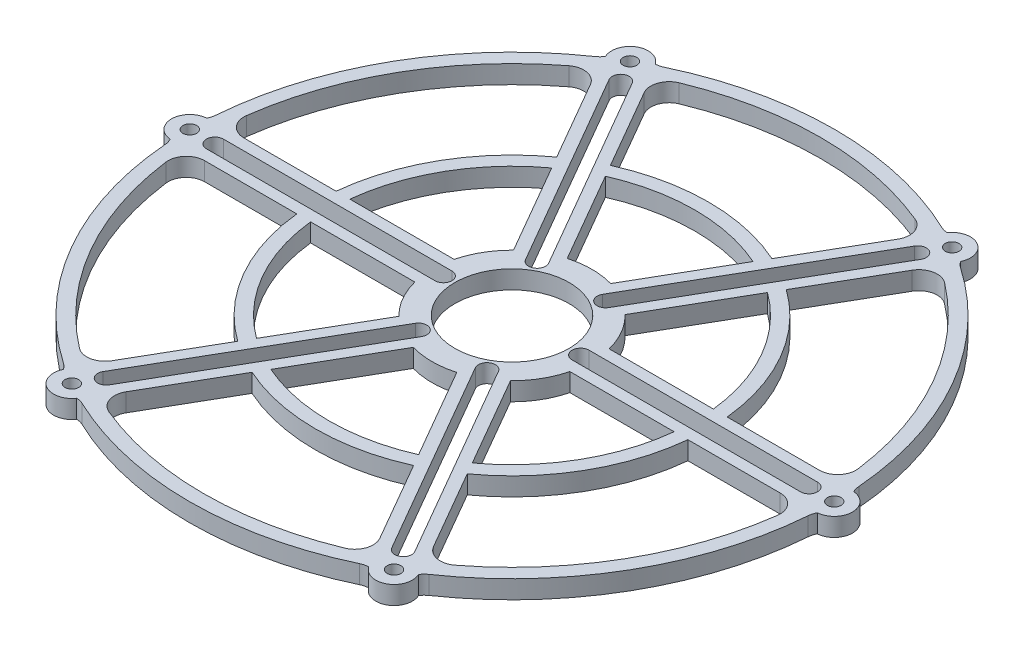
from build123d import *
from build123d.topology import SkipClean

# Parameters (mm, degrees)
SKETCH_1_R           = 1.4999999999999996
SKETCH_1_R_2         = 1.4999999999999998
SKETCH_1_R_3         = 1.5
SKETCH_1_R_4         = 1.4999999999999993
SKETCH_1_R_5         = 1.4999999999999971
SKETCH_1_R_6         = 1.5000000000000007
SKETCH_1_R_7         = 1.4999999999999944
SKETCH_1_R_8         = 1.4999999999999918
SKETCH_1_R_9         = 1.4999999999999887
SKETCH_1_R_10        = 4.5
EXTRUDE_1_DEPTH      = 4
FILLET_1_R           = 4
FILLET_2_R           = 4
EXTRUDE_2_DEPTH      = 5
EXTRUDE_2_DEPTH_BACK = 9
CHAMFER_1_SIZE       = 0.5
SKETCH_3_R           = 43
SKETCH_3_R_2         = 40
EXTRUDE_3_DEPTH      = 4
SKETCH_4_R           = 12.5
CUT_EXTRUDE_1_DEPTH  = 10
SKETCH_5_R           = 17.500000000000004
SKETCH_5_R_2         = 12.5
EXTRUDE_4_DEPTH      = 4
SKETCH_7_R           = 99.6246168555559
CUT_EXTRUDE_3_DEPTH  = 33
SKETCH_8_R           = 104.70068375535166
CUT_EXTRUDE_4_DEPTH  = 205.00000000000003
SKETCH_9_R           = 4.000000000000007
SKETCH_9_R_2         = 1.4999999999999973
SKETCH_9_R_3         = 3.999999999998955
SKETCH_9_R_4         = 1.4999999999989577
SKETCH_9_R_5         = 4.000000000001806
SKETCH_9_R_6         = 1.500000000001791
SKETCH_9_R_7         = 4.0000000000058265
SKETCH_9_R_8         = 1.500000000005815
SKETCH_9_R_9         = 4.000000000007099
SKETCH_9_R_10        = 1.5000000000070977
SKETCH_9_R_11        = 4.000000000004524
SKETCH_9_R_12        = 1.5000000000045177
EXTRUDE_5_DEPTH      = 4
CUT_EXTRUDE_5_DEPTH  = 10


with BuildPart() as part:
    # 草图1 → 凸台-拉伸1 (new body)
    with BuildSketch(Plane(origin=(0, 0, 0), x_dir=(1, 0, 0), z_dir=(0, 1, 0))):
        with BuildLine():
            ThreePointArc((-70.5, 3.000000000000008), (-73.50000000000001, 3.7e-16), (-70.5, -3.000000000000008))
            ThreePointArc((-70.5, -3.000000000000008), (-61.11004418260574, -35.281900459016875), (-37.84807621135403, -59.55479096680248))
            ThreePointArc((-37.84807621135403, -59.55479096680248), (-36.75000000000076, -63.65286717815582), (-32.65192378864741, -62.55479096680256))
            ThreePointArc((-32.65192378864741, -62.55479096680256), (-7.3209e-13, -70.56380091803446), (32.65192378864611, -62.55479096680326))
            ThreePointArc((32.65192378864611, -62.55479096680326), (36.74999999999942, -63.65286717815661), (37.848076211352776, -59.5547909668033))
            ThreePointArc((37.848076211352776, -59.5547909668033), (61.110044182605264, -35.281900459017756), (70.49999999999999, -3.0000000000005))
            ThreePointArc((70.49999999999999, -3.0000000000005), (73.50000000000001, -5.1362e-13), (70.50000000000003, 2.9999999999995155))
            ThreePointArc((70.50000000000003, 2.9999999999995155), (61.11004418260573, 35.28190045901688), (37.84807621135361, 59.55479096680278))
            ThreePointArc((37.84807621135361, 59.55479096680278), (36.75000000000032, 63.65286717815611), (32.65192378864698, 62.55479096680282))
            ThreePointArc((32.65192378864698, 62.55479096680282), (2.3935e-13, 70.5638009180345), (-32.65192378864655, 62.55479096680301))
            ThreePointArc((-32.65192378864655, 62.55479096680301), (-36.74999999999988, 63.65286717815634), (-37.84807621135321, 59.55479096680301))
            ThreePointArc((-37.84807621135321, 59.55479096680301), (-61.110044182605506, 35.281900459017315), (-70.5, 3.000000000000008))
        make_face()
        with Locations(Location((-8, 0, 0), (0, 0, 270))):
            Circle(SKETCH_1_R, mode=Mode.SUBTRACT)
        with Locations(Location((2.793e-14, 8, 0), (0, 0, 270))):
            Circle(SKETCH_1_R_2, mode=Mode.SUBTRACT)
        with Locations(Location((8, -5.586e-14, 0), (0, 0, 270))):
            Circle(SKETCH_1_R_3, mode=Mode.SUBTRACT)
        with Locations(Location((-8.38e-14, -7.999999999999998, 0), (0, 0, 270))):
            Circle(SKETCH_1_R_4, mode=Mode.SUBTRACT)
        with Locations(Location((-70.5, 0, 0), (0, 0, 270))):
            Circle(SKETCH_1_R_5, mode=Mode.SUBTRACT)
        with Locations(Location((-35.24999999999988, 61.05479096680301, 0), (0, 0, 270))):
            Circle(SKETCH_1_R_5, mode=Mode.SUBTRACT)
        with Locations(Location((35.2500000000003, 61.0547909668028, 0), (0, 0, 270))):
            Circle(SKETCH_1_R_6, mode=Mode.SUBTRACT)
        with Locations(Location((70.5, -4.923e-13, 0), (0, 0, 270))):
            Circle(SKETCH_1_R_7, mode=Mode.SUBTRACT)
        with Locations(Location((35.24999999999944, -61.05479096680328, 0), (0, 0, 270))):
            Circle(SKETCH_1_R_8, mode=Mode.SUBTRACT)
        with Locations(Location((-35.25000000000072, -61.054790966802514, 0), (0, 0, 270))):
            Circle(SKETCH_1_R_9, mode=Mode.SUBTRACT)
        with Locations(Location((0, 0, 0), (0, 0, 270))):
            Circle(SKETCH_1_R_10, mode=Mode.SUBTRACT)
        with BuildLine():
            Line((-67.36288251105003, 4.300239505244943), (-9.579036496304667, 4.3002395052442415))
            ThreePointArc((-9.579036496304667, 4.3002395052442415), (-9.093266739736535, 5.250000000000124), (-8.513634902051102, 6.145569196956236))
            Line((-8.513634902051102, 6.145569196956236), (-37.405557909423486, 56.187847774094074))
            ThreePointArc((-37.405557909423486, 56.187847774094074), (-58.45671475544931, 33.75000000000055), (-67.36288251105003, 4.300239505244943))
        make_face(mode=Mode.SUBTRACT)
        with BuildLine():
            Line((-67.36288251105012, -4.300239505243795), (-9.579036496304774, -4.300239505243998))
            ThreePointArc((-9.579036496304774, -4.300239505243998), (-9.093266739736634, -5.249999999999946), (-8.513634902051185, -6.145569196956118))
            Line((-8.513634902051185, -6.145569196956118), (-37.405557909424274, -56.18784777409356))
            ThreePointArc((-37.405557909424274, -56.18784777409356), (-58.45671475544982, -33.749999999999666), (-67.36288251105012, -4.300239505243795))
        make_face(mode=Mode.SUBTRACT)
        with BuildLine():
            Line((9.579036496304996, 4.300239505243507), (67.36288251105015, 4.300239505243303))
            ThreePointArc((67.36288251105015, 4.300239505243303), (58.45671475544981, 33.74999999999966), (37.40555790942386, 56.187847774093825))
            Line((37.40555790942386, 56.187847774093825), (8.513634902050875, 6.145569196956556))
            ThreePointArc((8.513634902050875, 6.145569196956556), (9.093266739736636, 5.249999999999946), (9.579036496304996, 4.300239505243507))
        make_face(mode=Mode.SUBTRACT)
        with BuildLine():
            Line((9.579036496304743, -4.3002395052440665), (67.36288251105009, -4.300239505244269))
            ThreePointArc((67.36288251105009, -4.300239505244269), (58.45671475544934, -33.7500000000005), (37.405557909423074, -56.18784777409434))
            Line((37.405557909423074, -56.18784777409434), (8.513634902050788, -6.145569196956676))
            ThreePointArc((8.513634902050788, -6.145569196956676), (9.093266739736448, -5.250000000000277), (9.579036496304743, -4.3002395052440665))
        make_face(mode=Mode.SUBTRACT)
        with BuildLine():
            Line((1.0654015942535602, -10.445808702200226), (29.957324601625945, -60.48808727933805))
            ThreePointArc((29.957324601625945, -60.48808727933805), (-7.1529e-13, -67.50000000000001), (-29.957324601627235, -60.48808727933743))
            Line((-29.957324601627235, -60.48808727933743), (-1.0654015942542432, -10.44580870220016))
            ThreePointArc((-1.0654015942542432, -10.44580870220016), (-3.4441e-13, -10.500000000000004), (1.0654015942535602, -10.445808702200226))
        make_face(mode=Mode.SUBTRACT)
        with BuildLine():
            Line((-29.957324601626386, 60.48808727933784), (-1.065401594254097, 10.44580870220017))
            ThreePointArc((-1.065401594254097, 10.44580870220017), (-1.952e-13, 10.500000000000004), (1.065401594253708, 10.445808702200214))
            Line((1.065401594253708, 10.445808702200214), (29.957324601626794, 60.48808727933765))
            ThreePointArc((29.957324601626794, 60.48808727933765), (2.1397e-13, 67.50000000000003), (-29.957324601626386, 60.48808727933784))
        make_face(mode=Mode.SUBTRACT)
    extrude(amount=EXTRUDE_1_DEPTH)

    # 圆角1
    fillet_1_edges = [part.edges().sort_by_distance(p)[0] for p in [
        (-32.651923788646556, 2, -62.554790966803),
        (32.65192378864698, 2, -62.55479096680281),
        (37.848076211353614, 2, -59.55479096680278),
        (70.50000000000003, 2, -2.9999999999995124),
        (70.49999999999997, 2, 3.000000000000502),
        (37.848076211352776, 2, 59.554790966803296),
        (32.651923788646116, 2, 62.55479096680326),
        (-32.65192378864741, 2, 62.55479096680256),
        (-37.84807621135403, 2, 59.55479096680247),
        (-70.5, 2, 3.0000000000000093),
        (-70.50000000000001, 2, -3.000000000000006),
        (-37.84807621135322, 2, -59.55479096680301),
        (29.95732460162595, 2, 60.48808727933806),
        (-29.957324601627235, 2, 60.488087279337435),
        (67.36288251105009, 2, 4.300239505244269),
        (37.40555790942308, 2, 56.18784777409434),
        (37.40555790942386, 2, -56.187847774093825),
        (67.36288251105015, 2, -4.300239505243303),
        (-29.957324601626382, 2, -60.48808727933785),
        (29.957324601626794, 2, -60.48808727933765),
        (-67.36288251105003, 2, -4.300239505244949),
        (-37.405557909423486, 2, -56.187847774094074),
        (-67.36288251105012, 2, 4.300239505243795),
        (-37.405557909424274, 2, 56.18784777409357),
    ]]
    fillet(fillet_1_edges, radius=FILLET_1_R)

    # 圆角2
    # the kernel refuses this fillet: 4 mm, written as the material it adds along each edge
    with BuildSketch(Plane(origin=(-1.0654015942542432, 0, 10.44580870220016), x_dir=(-0.5000000000000078, 0, 0.8660254037844342), z_dir=(0, 1, 0))) as fillet_2_piece_1:
        with BuildLine():
            CenterArc((2.3102874607429955, 4), FILLET_2_R, 214.91987318118674, 55.08012681881331)
            ThreePointArc((-0.9695260446492286, 1.7102787571744102), (-0.4446468956616131, 0.8778804840632203), (0, 0))
            Line((0, 0), (2.3102874607429986, 1e-17))
        make_face()
    extrude(amount=4)
    with BuildSketch(Plane(origin=(-8.513634902051187, 0, 6.145569196956119), x_dir=(-0.5068146140540691, 0, -0.8620550718957722), z_dir=(0, 1, 0))) as fillet_2_piece_2:
        with BuildLine():
            CenterArc((2.340439306766948, 3.982432925059041), FILLET_2_R, 209.54811525747954, 55.080126818827125)
            Line((-1.139328160145285, 2.0098157862763477), (0, 0))
            ThreePointArc((0, 0), (0.9829845088421216, 0.04611357172001829), (1.9659690176842408, -7e-17))
        make_face()
    extrude(amount=4)
    with BuildSketch(Plane(origin=(-9.579036496304774, 0, 4.300239505243998), x_dir=(-1, 0, -3.46e-15), z_dir=(0, 1, 0))) as fillet_2_piece_3:
        with BuildLine():
            CenterArc((2.310287460742878, 4), FILLET_2_R, 214.919873181189, 55.08012681881098)
            ThreePointArc((-0.9695260446492574, 1.7102787571742806), (-0.44464689566163024, 0.8778804840631562), (0, 0))
            Line((0, 0), (2.3102874607428774, 0))
        make_face()
    extrude(amount=4)
    with BuildSketch(Plane(origin=(-9.579036496304667, 0, -4.300239505244242), x_dir=(-1, 0, -1.23e-14), z_dir=(0, 1, 0))) as fillet_2_piece_4:
        with BuildLine():
            CenterArc((2.3102874607428503, -4), FILLET_2_R, 90.00000000000003, 55.080126818810555)
            ThreePointArc((-0.9695260446492677, -1.7102787571742577), (-0.4446468956616377, -0.8778804840631446), (0, 0))
            Line((0, 0), (2.310287460742849, 0))
        make_face()
    extrude(amount=4)
    with BuildSketch(Plane(origin=(-8.513634902051102, 0, -6.145569196956237), x_dir=(-0.499999999999995, 0, -0.8660254037844415), z_dir=(0, 1, 0))) as fillet_2_piece_5:
        with BuildLine():
            CenterArc((2.3102874607429045, 3.999999999999999), FILLET_2_R, 214.9198731811887, 55.080126818811266)
            ThreePointArc((-0.9695260446492415, 1.7102787571742961), (-0.444646895661633, 0.8778804840631592), (0, 0))
            Line((0, 0), (2.310287460742904, 0))
        make_face()
    extrude(amount=4)
    with BuildSketch(Plane(origin=(1.0654015942537083, 0, -10.445808702200214), x_dir=(0.5000000000000069, 0, -0.8660254037844347), z_dir=(0, 1, 0))) as fillet_2_piece_6:
        with BuildLine():
            CenterArc((2.310287460742857, 4), FILLET_2_R, 214.9198731811894, 55.080126818810584)
            ThreePointArc((-0.9695260446492627, 1.71027875717426), (-0.44464689566162524, 0.877880484063151), (0, 0))
            Line((0, 0), (2.3102874607428556, 1e-17))
        make_face()
    extrude(amount=4)
    with BuildSketch(Plane(origin=(-1.065401594254097, 0, -10.445808702200171), x_dir=(-0.4999999999999967, 0, -0.8660254037844406), z_dir=(0, 1, 0))) as fillet_2_piece_7:
        with BuildLine():
            CenterArc((2.310287460742986, -4.000000000000001), FILLET_2_R, 89.99999999999989, 55.08012681881317)
            ThreePointArc((-0.9695260446492305, -1.7102787571743998), (-0.4446468956616063, -0.8778804840632195), (0, 0))
            Line((0, 0), (2.310287460742994, 1.1e-16))
        make_face()
    extrude(amount=4)
    with BuildSketch(Plane(origin=(9.579036496304997, 0, -4.300239505243507), x_dir=(-0.4931542846958736, 0, -0.8699418667279448), z_dir=(0, 1, 0))) as fillet_2_piece_8:
        with BuildLine():
            CenterArc((2.340439306767078, -3.9824329250590407), FILLET_2_R, 95.37175792369351, 55.08012681882957)
            Line((-1.1393281601452454, -2.009815786276506), (0, 0))
            ThreePointArc((0, 0), (0.9829845088421809, -0.04611357172001845), (1.9659690176843594, 3e-17))
        make_face()
    extrude(amount=4)
    with BuildSketch(Plane(origin=(8.513634902050875, 0, -6.145569196956556), x_dir=(0.5000000000000061, 0, -0.866025403784435), z_dir=(0, 1, 0))) as fillet_2_piece_9:
        with BuildLine():
            CenterArc((2.310287460742994, -4.000000000000001), FILLET_2_R, 89.99999999999994, 55.08012681881351)
            ThreePointArc((-0.9695260446492374, -1.7102787571744216), (-0.4446468956616173, -0.8778804840632259), (0, 0))
            Line((0, 0), (2.310287460742998, 0))
        make_face()
    extrude(amount=4)
    with BuildSketch(Plane(origin=(9.579036496304745, 0, 4.300239505244067), x_dir=(-0.4931542846959206, 0, 0.8699418667279182), z_dir=(0, 1, 0))) as fillet_2_piece_10:
        with BuildLine():
            CenterArc((2.3404393067669447, 3.982432925059042), FILLET_2_R, 209.54811525747962, 55.080126818827125)
            Line((-1.1393281601452858, 2.0098157862763437), (0, 0))
            ThreePointArc((0, 0), (0.9829845088421215, 0.04611357172001889), (1.9659690176842441, -6e-17))
        make_face()
    extrude(amount=4)
    with BuildSketch(Plane(origin=(8.51363490205079, 0, 6.145569196956677), x_dir=(0.49999999999999556, 0, 0.8660254037844412), z_dir=(0, 1, 0))) as fillet_2_piece_11:
        with BuildLine():
            CenterArc((2.3102874607429924, 4), FILLET_2_R, 214.91987318118663, 55.08012681881331)
            ThreePointArc((-0.969526044649238, 1.7102787571744165), (-0.44464689566161586, 0.8778804840632238), (0, 0))
            Line((0, 0), (2.31028746074299, 0))
        make_face()
    extrude(amount=4)
    with BuildSketch(Plane(origin=(1.0654015942535602, 0, 10.445808702200226), x_dir=(-0.999968898749994, 0, 0.007886794832146953), z_dir=(0, 1, 0))) as fillet_2_piece_12:
        with BuildLine():
            CenterArc((2.340439306766954, 3.982432925059041), FILLET_2_R, 209.5481152574794, 55.08012681882724)
            Line((-1.1393281601452845, 2.009815786276356), (0, 0))
            ThreePointArc((0, 0), (0.9829845088421225, 0.04611357172001738), (1.965969017684245, 0))
        make_face()
    extrude(amount=4)

    # 草图2 → 凸台-拉伸2 (add, two sides: drawn at the far end of the back side and taken through both)
    with SkipClean():  # the faces are left unmerged after this step: merging them gives an invalid solid
        with BuildSketch(Plane(origin=(0, 0, 0), x_dir=(-1, 0, 0), z_dir=(0, -1, 0)).offset(-EXTRUDE_2_DEPTH_BACK)):
            with BuildLine():
                Line((23.0863596744827, -63.429251903048794), (23.5993898894712, -64.83879083422764))
                ThreePointArc((23.5993898894712, -64.83879083422764), (4.23e-15, -68.99999999999999), (-23.5993898894712, -64.83879083422764))
                Line((-23.5993898894712, -64.83879083422764), (-23.0863596744827, -63.429251903048794))
                ThreePointArc((-23.0863596744827, -63.429251903048794), (4.13e-15, -67.5), (23.0863596744827, -63.429251903048794))
            make_face()
            with BuildLine():
                Line((-43.38816365384148, -51.70799991053096), (-44.352345068371285, -52.85706657520941))
                ThreePointArc((-44.352345068371285, -52.85706657520941), (-59.75575286112633, -34.49999999999986), (-67.95173495784238, -11.981724259017966))
                Line((-67.95173495784238, -11.981724259017966), (-66.4745233283241, -11.721251992517583))
                ThreePointArc((-66.4745233283241, -11.721251992517583), (-58.4567147554497, -33.74999999999988), (-43.38816365384148, -51.70799991053096))
            make_face()
            with BuildLine():
                Line((-66.47452332832401, 11.721251992518056), (-67.9517349578423, 11.981724259018446))
                ThreePointArc((-67.9517349578423, 11.981724259018446), (-59.755752861126105, 34.50000000000029), (-44.352345068370916, 52.857066575209736))
                Line((-44.352345068370916, 52.857066575209736), (-43.388163653841126, 51.70799991053128))
                ThreePointArc((-43.388163653841126, 51.70799991053128), (-58.45671475544946, 33.75000000000029), (-66.47452332832401, 11.721251992518056))
            make_face()
            with BuildLine():
                Line((-23.086359674482257, 63.429251903048964), (-23.599389889470746, 64.83879083422781))
                ThreePointArc((-23.599389889470746, 64.83879083422781), (4.945e-13, 68.99999999999997), (23.599389889471656, 64.83879083422747))
                Line((23.599389889471656, 64.83879083422747), (23.086359674483145, 63.42925190304863))
                ThreePointArc((23.086359674483145, 63.42925190304863), (4.6876e-13, 67.5), (-23.086359674482257, 63.429251903048964))
            make_face()
            with BuildLine():
                Line((43.388163653841836, 51.70799991053065), (44.35234506837164, 52.8570665752091))
                ThreePointArc((44.35234506837164, 52.8570665752091), (59.755752861126574, 34.49999999999944), (67.95173495784246, 11.981724259017493))
                Line((67.95173495784246, 11.981724259017493), (66.47452332832417, 11.721251992517116))
                ThreePointArc((66.47452332832417, 11.721251992517116), (58.45671475544992, 33.74999999999946), (43.388163653841836, 51.70799991053065))
            make_face()
            with BuildLine():
                Line((66.47452332832391, -11.721251992518493), (67.9517349578422, -11.981724259018899))
                ThreePointArc((67.9517349578422, -11.981724259018899), (59.75575286112585, -34.500000000000675), (44.35234506837053, -52.85706657521001))
                Line((44.35234506837053, -52.85706657521001), (43.388163653840756, -51.70799991053155))
                ThreePointArc((43.388163653840756, -51.70799991053155), (58.45671475544921, -33.75000000000066), (66.47452332832391, -11.721251992518493))
            make_face()
        extrude(amount=EXTRUDE_2_DEPTH + EXTRUDE_2_DEPTH_BACK)

    # 倒角1
    chamfer_1_edges = [part.edges().sort_by_distance(p)[0] for p in [
        (7.11e-15, -5, 68.99999999999997),
        (59.75575286112634, -5, 34.49999999999986),
        (59.755752861126126, -5, -34.5000000000003),
        (-4.8939e-13, -5, -68.99999999999997),
        (-59.75575286112658, -5, -34.49999999999944),
        (-59.755752861125856, -5, 34.50000000000067),
    ]]
    chamfer(chamfer_1_edges, length=CHAMFER_1_SIZE)

    # 草图3 → 凸台-拉伸3 (add)
    with SkipClean():  # the faces are left unmerged after this step: merging them gives an invalid solid
        with BuildSketch(Plane(origin=(0, 4, 0), x_dir=(1, 0, 0), z_dir=(0, 1, 0))):
            Circle(SKETCH_3_R)
            Circle(SKETCH_3_R_2, mode=Mode.SUBTRACT)
        extrude(amount=-EXTRUDE_3_DEPTH)

    # 草图4 → 切除-拉伸1 (cut)
    with SkipClean():  # the faces are left unmerged after this step: merging them gives an invalid solid
        with BuildSketch(Plane(origin=(0, 4, 0), x_dir=(1, 0, 0), z_dir=(0, 1, 0))):
            Circle(SKETCH_4_R)
        extrude(amount=-CUT_EXTRUDE_1_DEPTH, mode=Mode.SUBTRACT)

    # 草图5 → 凸台-拉伸4 (add)
    with SkipClean():  # the faces are left unmerged after this step: merging them gives an invalid solid
        with BuildSketch(Plane(origin=(0, 4, 0), x_dir=(1, 0, 0), z_dir=(0, 1, 0))):
            Circle(SKETCH_5_R)
            with Locations(Location((0, 0, 0), (0, 0, 270))):
                Circle(SKETCH_5_R_2, mode=Mode.SUBTRACT)
        extrude(amount=-EXTRUDE_4_DEPTH)

    # 草图7 → 切除-拉伸3 (cut)
    with BuildSketch(Plane(origin=(0, 0, 0), x_dir=(-1, 0, 0), z_dir=(0, -1, 0))):
        Circle(SKETCH_7_R)
    extrude(amount=CUT_EXTRUDE_3_DEPTH, mode=Mode.SUBTRACT)

    # 草图8 → 切除-拉伸4 (cut)
    with BuildSketch(Plane(origin=(0, 4, 0), x_dir=(1, 0, 0), z_dir=(0, 1, 0))):
        Circle(SKETCH_8_R)
    extrude(amount=CUT_EXTRUDE_4_DEPTH, mode=Mode.SUBTRACT)

    # 草图9 → 凸台-拉伸5 (add)
    # profile 1 of 6: a face of its own
    with BuildSketch(Plane(origin=(0, 0, 0), x_dir=(-1, 0, 0), z_dir=(0, -1, 0))):
        with Locations((35.24999999999988, 61.05479096680301)):
            Circle(SKETCH_9_R)
        with Locations(Location((35.24999999999988, 61.05479096680301, 0), (0, 0, 270))):
            Circle(SKETCH_9_R_2, mode=Mode.SUBTRACT)
    # profile 2 of 6: a face of its own
    with BuildSketch(Plane(origin=(0, 0, 0), x_dir=(-1, 0, 0), z_dir=(0, -1, 0))):
        with Locations((70.5000000000035, 2.17193e-12)):
            Circle(SKETCH_9_R_3)
        with Locations(Location((70.5000000000035, 2.17193e-12, 0), (0, 0, 270))):
            Circle(SKETCH_9_R_4, mode=Mode.SUBTRACT)
    # profile 3 of 6: a face of its own
    with BuildSketch(Plane(origin=(0, 0, 0), x_dir=(-1, 0, 0), z_dir=(0, -1, 0))):
        with Locations((35.2500000000071, -61.05479096680287)):
            Circle(SKETCH_9_R_5)
        with Locations(Location((35.2500000000071, -61.05479096680287, 0), (0, 0, 270))):
            Circle(SKETCH_9_R_6, mode=Mode.SUBTRACT)
    # profile 4 of 6: a face of its own
    with BuildSketch(Plane(origin=(0, 0, 0), x_dir=(-1, 0, 0), z_dir=(0, -1, 0))):
        with Locations((-35.24999999999293, -61.05479096680704)):
            Circle(SKETCH_9_R_7)
        with Locations(Location((-35.24999999999293, -61.05479096680704, 0), (0, 0, 270))):
            Circle(SKETCH_9_R_8, mode=Mode.SUBTRACT)
    # profile 5 of 6: a face of its own
    with BuildSketch(Plane(origin=(0, 0, 0), x_dir=(-1, 0, 0), z_dir=(0, -1, 0))):
        with Locations((-70.49999999999656, -6.20346e-12)):
            Circle(SKETCH_9_R_9)
        with Locations(Location((-70.49999999999656, -6.20346e-12, 0), (0, 0, 270))):
            Circle(SKETCH_9_R_10, mode=Mode.SUBTRACT)
    # profile 6 of 6: a face of its own
    with BuildSketch(Plane(origin=(0, 0, 0), x_dir=(-1, 0, 0), z_dir=(0, -1, 0))):
        with Locations((-35.25000000000019, 61.05479096679882)):
            Circle(SKETCH_9_R_11)
        with Locations(Location((-35.25000000000019, 61.05479096679882, 0), (0, 0, 270))):
            Circle(SKETCH_9_R_12, mode=Mode.SUBTRACT)
    extrude(amount=-EXTRUDE_5_DEPTH)

    # 草图10 → 切除-拉伸5 (cut)
    with BuildSketch(Plane(origin=(0, 4, 0), x_dir=(1, 0, 0), z_dir=(0, 1, 0))):
        with BuildLine():
            Line((-65, 1.851415747497573), (-15, 1.851415747497582))
            ThreePointArc((-15, 1.851415747497582), (-13.148584252502427, 9.18e-15), (-15, -1.8514157474975639))
            Line((-15, -1.8514157474975639), (-65, -1.851415747497573))
            ThreePointArc((-65, -1.851415747497573), (-66.85141574749757, 2.3e-16), (-65, 1.851415747497573))
        make_face()
        with BuildLine():
            Line((-30.896626929700414, 57.21735911973737), (-5.896626929700505, 13.916088930515382))
            ThreePointArc((-5.896626929700505, 13.916088930515382), (-6.574292126251178, 11.387007986467143), (-9.103373070299417, 12.064673183017815))
            Line((-9.103373070299417, 12.064673183017815), (-34.10337307029933, 55.36594337223981))
            ThreePointArc((-34.10337307029933, 55.36594337223981), (-33.42570787374865, 57.895024316288044), (-30.896626929700414, 57.21735911973737))
        make_face()
        with BuildLine():
            Line((34.10337307029971, 55.36594337223958), (9.103373070299513, 12.064673183017748))
            ThreePointArc((9.103373070299513, 12.064673183017748), (6.574292126251267, 11.38700798646709), (5.896626929700612, 13.916088930515336))
            Line((5.896626929700612, 13.916088930515336), (30.89662692970081, 57.21735911973717))
            ThreePointArc((30.89662692970081, 57.21735911973717), (33.425707873749054, 57.89502431628783), (34.10337307029971, 55.36594337223958))
        make_face()
        with BuildLine():
            Line((64.99999999999999, -1.8514157474980268), (14.999999999999988, -1.851415747497687))
            ThreePointArc((14.999999999999988, -1.851415747497687), (13.148584252502427, -1.0137e-13), (15.000000000000012, 1.8514157474974593))
            Line((15.000000000000012, 1.8514157474974593), (65.00000000000001, 1.8514157474971193))
            ThreePointArc((65.00000000000001, 1.8514157474971193), (66.85141574749757, -4.6828e-13), (64.99999999999999, -1.8514157474980268))
        make_face()
        with BuildLine():
            Line((30.896626929700027, -57.217359119737594), (5.896626929700416, -13.91608893051544))
            ThreePointArc((5.896626929700416, -13.91608893051544), (6.574292126251105, -11.387007986467205), (9.103373070299341, -12.064673183017895))
            Line((9.103373070299341, -12.064673183017895), (34.10337307029895, -55.365943372240054))
            ThreePointArc((34.10337307029895, -55.365943372240054), (33.42570787374826, -57.895024316288286), (30.896626929700027, -57.217359119737594))
        make_face()
        with BuildLine():
            Line((-34.10337307030011, -55.365943372239336), (-9.103373070299602, -12.064673183017685))
            ThreePointArc((-9.103373070299602, -12.064673183017685), (-6.574292126251354, -11.387007986467045), (-5.896626929700716, -13.916088930515295))
            Line((-5.896626929700716, -13.916088930515295), (-30.896626929701217, -57.217359119736955))
            ThreePointArc((-30.896626929701217, -57.217359119736955), (-33.42570787374947, -57.89502431628759), (-34.10337307030011, -55.365943372239336))
        make_face()
    extrude(amount=-CUT_EXTRUDE_5_DEPTH, mode=Mode.SUBTRACT)


solid = part.part
